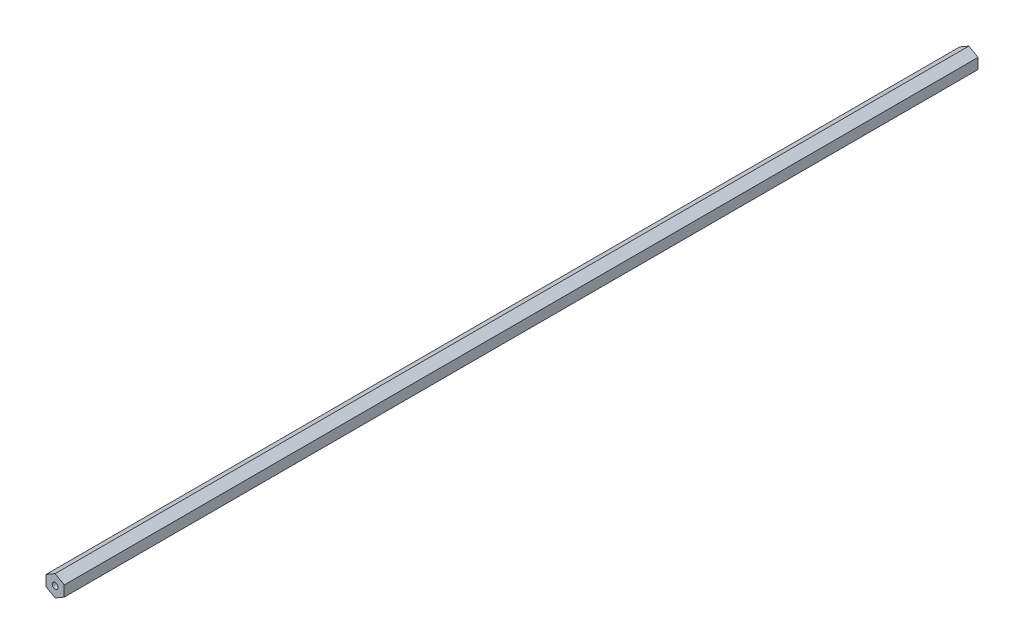
from build123d import *

# Parameters (mm, degrees)
BOSS_EXTRUDE1_DEPTH                  = 318.04229
F_10_32_TAPPED_HOLE1_D               = 4.0386
F_10_32_TAPPED_HOLE1_DEPTH           = 16.34744
F_10_32_TAPPED_HOLE1_TIP             = 1.213317848
F_10_32_TAPPED_HOLE1_ON_FACE_2_D     = 4.0386
F_10_32_TAPPED_HOLE1_ON_FACE_2_DEPTH = 16.34744
F_10_32_TAPPED_HOLE1_ON_FACE_2_TIP   = 1.213317848


with BuildPart() as part:
    # Sketch1 → Boss-Extrude1 (new, symmetric)
    with BuildSketch(Plane.XY):
        Polygon((6.35, -3.666174209), (6.35, 3.666174209), (0, 7.332348419), (-6.35, 3.666174209), (-6.35, -3.666174209), (0, -7.332348419), align=None)
    extrude(amount=BOSS_EXTRUDE1_DEPTH, both=True)

    # #10-32 Tapped Hole1
    with Locations(Plane.XY.offset(318.04229)):
        with Locations((0, 0)):
            Hole(F_10_32_TAPPED_HOLE1_D / 2, depth=F_10_32_TAPPED_HOLE1_DEPTH)
            with Locations((0, 0, -(F_10_32_TAPPED_HOLE1_DEPTH + F_10_32_TAPPED_HOLE1_TIP / 2))):  # 118° drill point
                Cone(0, F_10_32_TAPPED_HOLE1_D / 2, F_10_32_TAPPED_HOLE1_TIP, mode=Mode.SUBTRACT)

    # #10-32 Tapped Hole1 on face 2
    with Locations(Plane(origin=(0, 0, -318.04229), x_dir=(-1, 0, 0), z_dir=(0, 0, -1))):
        with Locations((0, 0)):
            Hole(F_10_32_TAPPED_HOLE1_ON_FACE_2_D / 2, depth=F_10_32_TAPPED_HOLE1_ON_FACE_2_DEPTH)
            with Locations((0, 0, -(F_10_32_TAPPED_HOLE1_ON_FACE_2_DEPTH + F_10_32_TAPPED_HOLE1_ON_FACE_2_TIP / 2))):  # 118° drill point
                Cone(0, F_10_32_TAPPED_HOLE1_ON_FACE_2_D / 2, F_10_32_TAPPED_HOLE1_ON_FACE_2_TIP, mode=Mode.SUBTRACT)


solid = part.part
